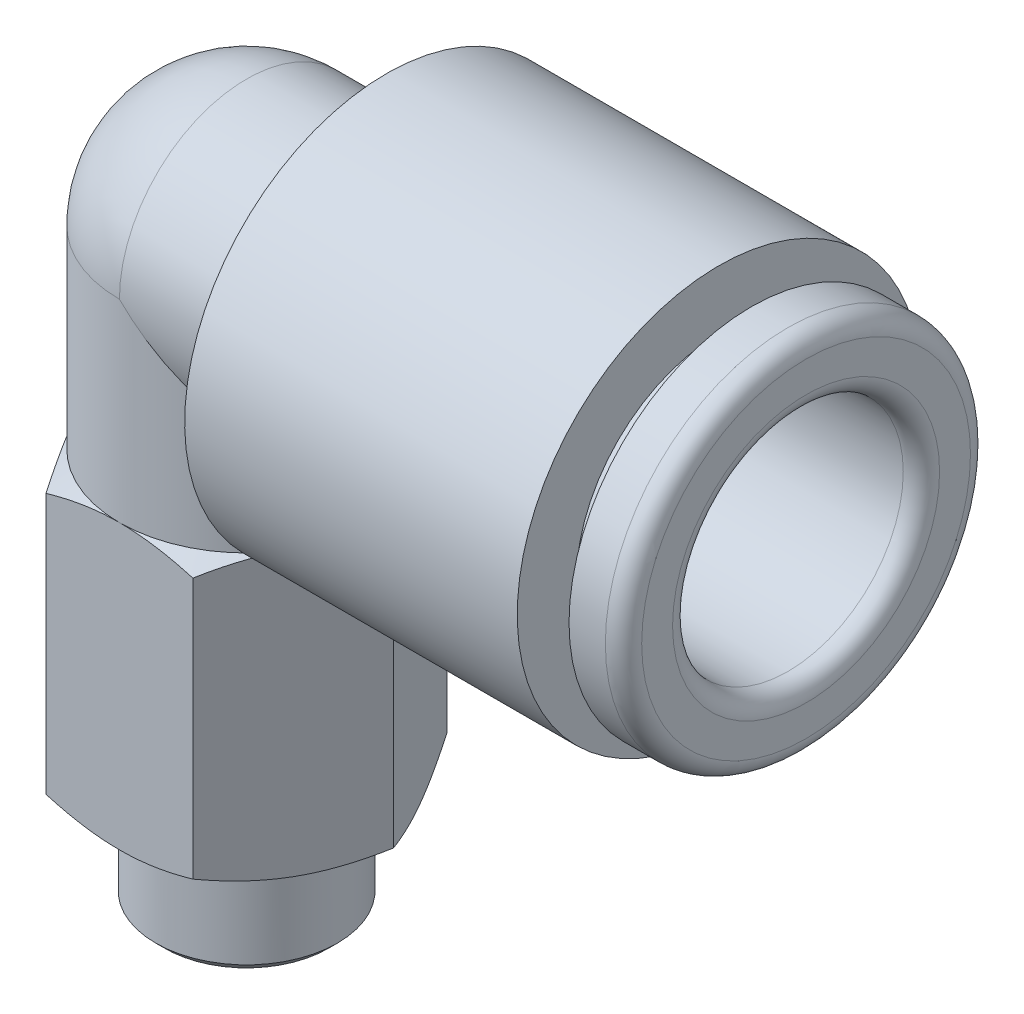
from build123d import *

# Parameters (mm, degrees)
SKETCH1_R             = 3.5
BASE_EXTRUDE_DEPTH    = 3.1
RBODY_SKETCH_R        = 5.55
RBODY_DEPTH           = 9.9
ELBOW_ANGLE           = 90
SKETCH3_R             = 3.5
BOSS_EXTRUDE1_DEPTH   = 5.33
NUT_DEPTH             = 7.8
THREADS_SKETCH_W      = 2.5
THREADS_SKETCH_H      = 2.975
THREAD_CHAMFER_SIZE   = 0.25
RTUBE_SKETCH_R        = 3.175
RTUBE_DEPTH           = 13.3
RTUBE_RADIUS_R        = 0.5
DIAMETER_R            = 1.5875
PORT_THREADS_REACH    = 29.142
PORT_THREADS_SKETCH_R = 1.5875


with BuildPart() as part:
    # Sketch1 → Base-Extrude (new body)
    with BuildSketch(Plane(origin=(0, 0, 0), x_dir=(0, 0, -1), z_dir=(1, 0, 0))):
        Circle(SKETCH1_R)
    extrude(amount=BASE_EXTRUDE_DEPTH)

    # RBody_Sketch → RBody (add)
    with BuildSketch(Plane(origin=(3.1, 0, 0), x_dir=(0, 0, -1), z_dir=(1, 0, 0))):
        Circle(RBODY_SKETCH_R)
    extrude(amount=RBODY_DEPTH)

    # RBody_Chamfer: read off the stored shape, not the designer's step
    # RBody_Chamfer outline → RBody_Chamfer (revolve, cut)
    with BuildSketch(Plane.YX):
        Polygon((5.55, 3.84613898), (3.5, 3.1), (5.55, 3.1), align=None)
    revolve(axis=Axis((0, 0, 0), (1, 0, 0)), mode=Mode.SUBTRACT)

    # RRelease_Sketch → RRelease (revolve)
    with BuildSketch(Plane.XY, mode=Mode.PRIVATE) as rrelease_sk:
        with BuildLine():
            Line((13, 3.925), (13.9, 3.925))
            Line((13.9, 3.925), (13.9, 5.025))
            Line((13.9, 5.025), (14.9, 5.025))
            ThreePointArc((14.9, 5.025), (15.253553391, 4.878553391), (15.4, 4.525))
            Line((15.4, 4.525), (15.4, 0))
            Line((15.4, 0), (13, 0))
            Line((13, 0), (13, 3.925))
        make_face()
    revolve(rrelease_sk.sketch.rotate(Axis((12.597722381, 0, 0), (1, 0, 0)), 90), axis=Axis((12.597722381, 0, 0), (1, 0, 0)))

    # Elbow_Sketch → Elbow (revolve)
    with BuildSketch(Plane.ZY):
        with BuildLine():
            Line((-3.5, 0), (3.5, 0))
            ThreePointArc((3.5, 0), (0, 3.5), (-3.5, 0))
        make_face()
    revolve(axis=Axis((0, 0, -6.487672297), (0, 0, 1)), revolution_arc=ELBOW_ANGLE)

    # Sketch3 → Boss-Extrude1 (add)
    with BuildSketch(Plane.XZ):
        with Locations(Location((0, 0, 0), (0, 0, 90))):
            Circle(SKETCH3_R)
    extrude(amount=BOSS_EXTRUDE1_DEPTH)

    # Nut_Sketch → Nut (add)
    with BuildSketch(Plane(origin=(0, -13.125, 0), x_dir=(-1, 0, 0), z_dir=(0, 1, 0))):
        Polygon((4.041451884, 0), (2.020725942, 3.5), (-2.020725942, 3.5), (-4.041451884, 0), (-2.020725942, -3.5), (2.020725942, -3.5), align=None)
    extrude(amount=NUT_DEPTH)

    # Nut_Chamfer_Sketch → Nut_Chamfer (revolve, cut)
    with BuildSketch(Plane.XY):
        Polygon((-3.5, -5.325), (-4.041451884, -5.325), (-4.041451884, -5.637607391), align=None)
        Polygon((-4.041451884, -12.812392609), (-3.5, -13.125), (-4.041451884, -13.125), align=None)
    revolve(axis=Axis((0, -1.551633987, 0), (0, 1, 0)), mode=Mode.SUBTRACT)

    # Threads_Sketch → Threads (revolve)
    with BuildSketch(Plane.XY):
        with Locations((-1.25, -14.6125)):
            Rectangle(THREADS_SKETCH_W, THREADS_SKETCH_H)
    revolve(axis=Axis((0, 0, 0), (0, -1, 0)))

    # Thread_Chamfer
    thread_chamfer_edges = [part.edges().sort_by_distance(p)[0] for p in [
        (2.5, -16.1, 0),
    ]]
    chamfer(thread_chamfer_edges, length=THREAD_CHAMFER_SIZE)

    # RTube_Sketch → RTube (cut)
    with BuildSketch(Plane(origin=(15.4, 0, 0), x_dir=(0, 0, -1), z_dir=(1, 0, 0))):
        Circle(RTUBE_SKETCH_R)
    extrude(amount=-RTUBE_DEPTH, mode=Mode.SUBTRACT)

    # RTube_Radius
    rtube_radius_edges = [part.edges().sort_by_distance(p)[0] for p in [
        (15.4, 0, 3.175),
    ]]
    fillet(rtube_radius_edges, radius=RTUBE_RADIUS_R)

    # Port_Curve: sweep along a path in Profile
    with BuildLine(Plane.XY) as port_curve_path:
        ThreePointArc((2.1, 0), (0.61507576, -0.61507576), (0, -2.1))
    # Diameter → Port_Curve (sweep, cut)
    with BuildSketch(Plane(origin=(2.1, 0, 0), x_dir=(0, 0, -1), z_dir=(1, 0, 0))):
        Circle(DIAMETER_R)
    sweep(path=port_curve_path.line, mode=Mode.SUBTRACT)

    # Port_Threads_Sketch → Port_Threads (cut, up to next)
    with BuildSketch(Plane(origin=(0, -16.1, 0), x_dir=(-1, 0, 0), z_dir=(0, 1, 0)), mode=Mode.PRIVATE) as port_threads_sk1:
        Circle(PORT_THREADS_SKETCH_R)
    port_threads_tool1 = extrude(port_threads_sk1.sketch, amount=PORT_THREADS_REACH, mode=Mode.PRIVATE) & part.part
    add(port_threads_tool1.solids().sort_by_distance((0, -16.1, 0))[0], mode=Mode.SUBTRACT)


solid = part.part
